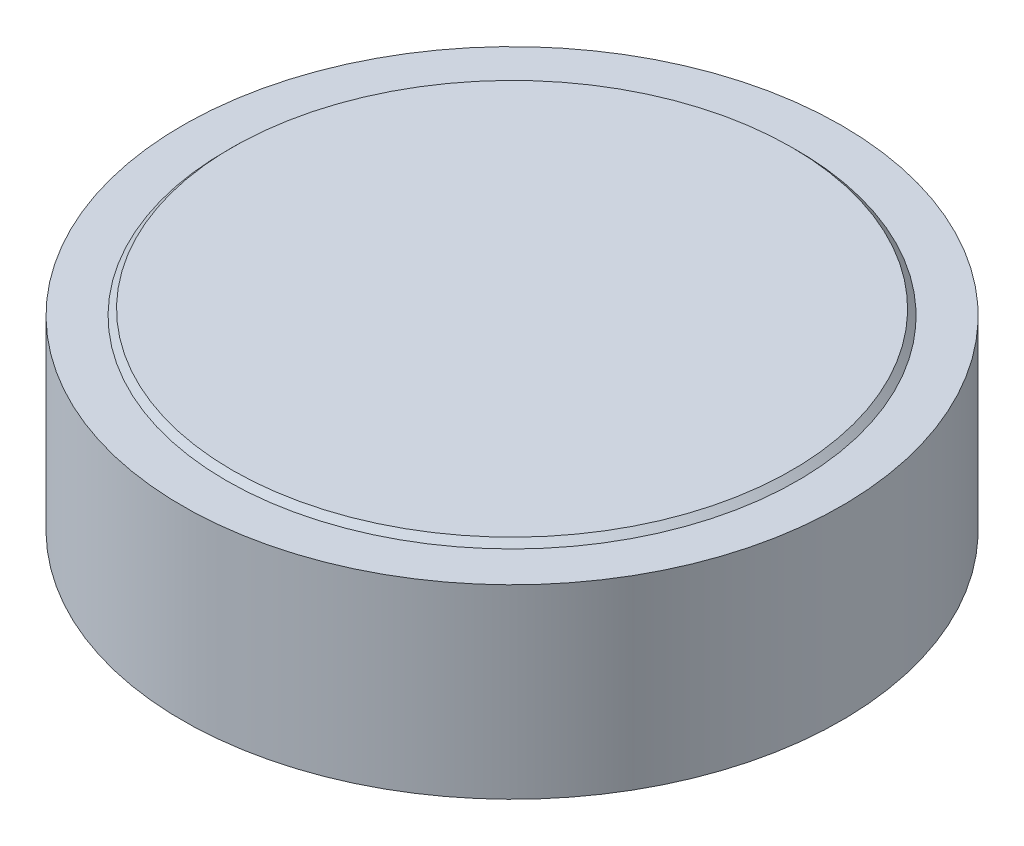
from build123d import *

# Parameters (mm, degrees)
SKETCH1_R           = 5.5
BOSS_EXTRUDE1_DEPTH = 3.1
SKETCH2_R           = 5.167835257
BOSS_EXTRUDE2_DEPTH = 0.1
CHAMFER1_SIZE       = 0.5


with BuildPart() as part:
    # Sketch1 → Boss-Extrude1 (new body)
    with BuildSketch(Plane(origin=(0, 0, 0), x_dir=(1, 0, 0), z_dir=(0, 1, 0))):
        with Locations(Location((0, 0, 0), (0, 0, 90))):
            Circle(SKETCH1_R)
    extrude(amount=BOSS_EXTRUDE1_DEPTH)

    # Sketch2 → Boss-Extrude2 (add)
    with BuildSketch(Plane(origin=(0, 3.1, 0), x_dir=(1, 0, 0), z_dir=(0, 1, 0))):
        with Locations(Location((0, 0, 0), (0, 0, 270))):
            Circle(SKETCH2_R)
    extrude(amount=BOSS_EXTRUDE2_DEPTH)

    # Chamfer1
    # the kernel refuses this chamfer: 0.5 mm, written as the material it takes off along each edge
    with BuildSketch(Plane(origin=(0, 3.2, 0), x_dir=(0, 0, 1), z_dir=(-1, 0, 0))) as chamfer1_piece_1_section:
        Polygon((5.167835257, -CHAMFER1_SIZE), (5.167835257 - CHAMFER1_SIZE, 0), (5.167835257, 0), align=None)
    chamfer1_piece_1 = revolve(axis=Axis((0, 3.2, 0), (0, 1, 0)), mode=Mode.PRIVATE)
    chamfer1_piece_1 = split(chamfer1_piece_1, bisect_by=Plane(origin=(0, 3.1, -4.719067591), z_dir=(0, 1, 0)), keep=Keep.TOP, mode=Mode.PRIVATE)
    add(chamfer1_piece_1, mode=Mode.SUBTRACT)


solid = part.part
